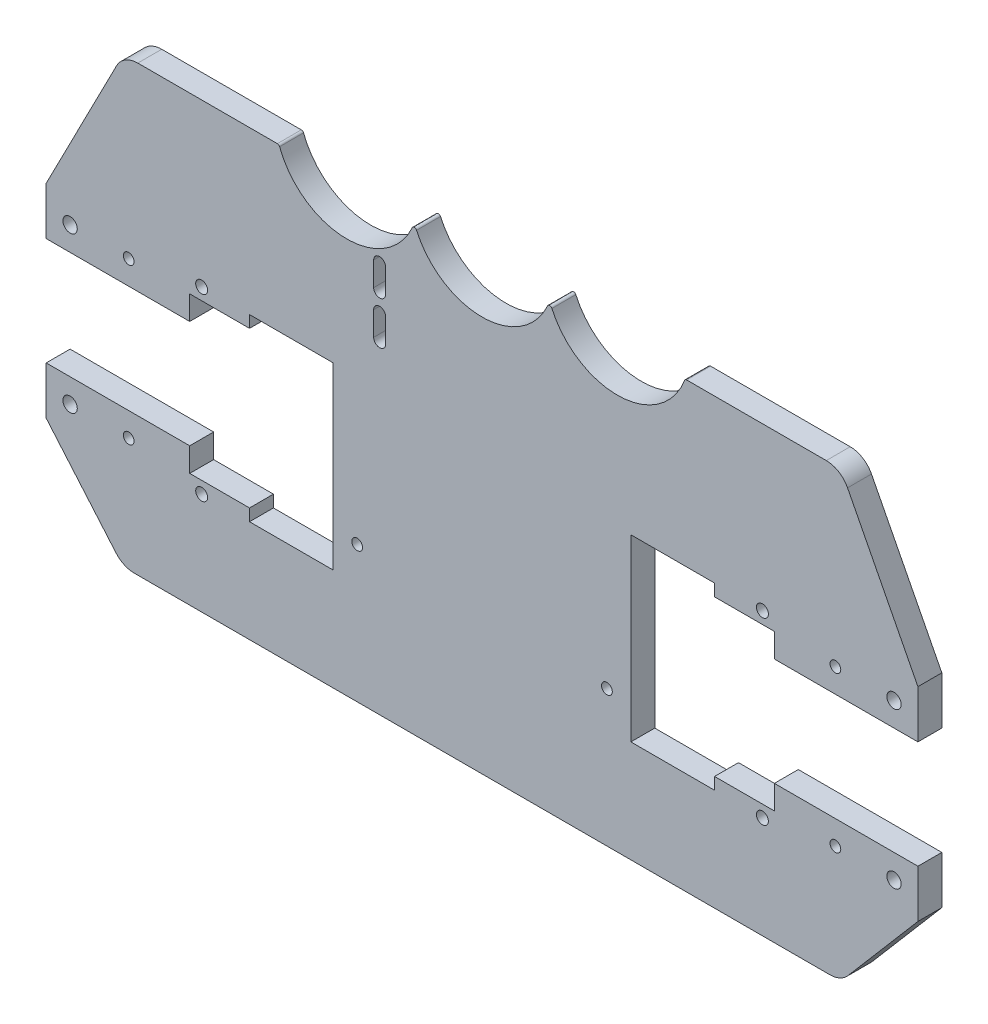
from build123d import *

# Parameters (mm, degrees)
BOSS_EXTRU_1_DEPTH           = 10
ENL_V_MAT_EXTRU_1_DEPTH      = 10
ENL_V_MAT_EXTRU_2_DEPTH      = 211.627348652
ENL_V_MAT_EXTRU_2_DEPTH_BACK = 10
ESQUISSE10_R                 = 2.25
ESQUISSE10_R_2               = 3
ENL_V_MAT_EXTRU_3_DEPTH      = 10
ESQUISSE15_R                 = 2.25
ENL_V_MAT_EXTRU_4_DEPTH      = 10
CONG_1_R                     = 10
CONG_3_R                     = 1
ENL_V_MAT_EXTRU_5_DEPTH      = 10
ESQUISSE18_R                 = 2.5
ENL_V_MAT_EXTRU_6_DEPTH      = 10


with BuildPart() as part:
    # Esquisse3 → Boss.-Extru.1 (new body)
    with BuildSketch(Plane.XY):
        Polygon((-150, 105.2), (-182.2, 42.5), (-182.2, -42.5), (-150, -80.2), (150, -80.2), (182.2, -42.5), (182.2, 42.5), (150, 105.2), align=None)
    extrude(amount=BOSS_EXTRU_1_DEPTH)

    # Esquisse4 → Enlèv. mat.-Extru.1 (cut)
    with BuildSketch(Plane.XY.offset(10)):
        Polygon((-97.2, 32.5), (-122.2, 32.5), (-122.2, 22.5), (-182.2, 22.5), (-182.2, -22.5), (-122.2, -22.5), (-122.2, -32.5), (-97.2, -32.5), (-97.2, -37.5), (-62.2, -37.5), (-62.2, 37.5), (-97.2, 37.5), align=None)
        Polygon((122.2, 22.5), (122.2, 32.5), (97.2, 32.5), (97.2, 37.5), (62.2, 37.5), (62.2, -37.5), (97.2, -37.5), (97.2, -32.5), (122.2, -32.5), (122.2, -22.5), (182.2, -22.5), (182.2, 22.5), align=None)
    extrude(amount=-ENL_V_MAT_EXTRU_1_DEPTH, mode=Mode.SUBTRACT)

    # Esquisse5 → Enlèv. mat.-Extru.2 (cut, two sides: drawn at the far end of the back side and taken through both)
    with BuildSketch(Plane.XY.offset(10).offset(-ENL_V_MAT_EXTRU_2_DEPTH_BACK)):
        with BuildLine():
            Line((304.919844735, 727.643559723), (84.852813742, 105.2))
            ThreePointArc((84.852813742, 105.2), (56.568542495, 85.2), (28.284271247, 105.2))
            ThreePointArc((28.284271247, 105.2), (0, 85.2), (-28.284271247, 105.2))
            ThreePointArc((-28.284271247, 105.2), (-56.568542495, 85.2), (-84.852813742, 105.2))
            Line((-84.852813742, 105.2), (-304.919844735, 727.643559723))
            Line((-304.919844735, 727.643559723), (-304.919844735, 2048.045745681))
            Line((-304.919844735, 2048.045745681), (304.919844735, 2048.045745681))
            Line((304.919844735, 2048.045745681), (304.919844735, 727.643559723))
        make_face()
    extrude(amount=ENL_V_MAT_EXTRU_2_DEPTH + ENL_V_MAT_EXTRU_2_DEPTH_BACK, mode=Mode.SUBTRACT)

    # Esquisse10 → Enlèv. mat.-Extru.3 (cut)
    with BuildSketch(Plane.XY.offset(10)):
        with Locations((-147.7, 32.5)):
            Circle(ESQUISSE10_R)
        with Locations((-172.2, 32.5)):
            Circle(ESQUISSE10_R_2)
        with Locations((-172.2, -32.5)):
            Circle(ESQUISSE10_R_2)
        with Locations((-147.7, -32.5)):
            Circle(ESQUISSE10_R)
        with Locations((172.2, 32.5)):
            Circle(ESQUISSE10_R_2)
        with Locations((147.7, 32.5)):
            Circle(ESQUISSE10_R)
        with Locations((172.2, -32.5)):
            Circle(ESQUISSE10_R_2)
        with Locations((147.7, -32.5)):
            Circle(ESQUISSE10_R)
    extrude(amount=-ENL_V_MAT_EXTRU_3_DEPTH, mode=Mode.SUBTRACT)

    # Esquisse15 → Enlèv. mat.-Extru.4 (cut)
    with BuildSketch(Plane.XY.offset(10)):
        with Locations((-52.2, -23.2)):
            Circle(ESQUISSE15_R)
        with Locations((52.2, -23.2)):
            Circle(ESQUISSE15_R)
    extrude(amount=-ENL_V_MAT_EXTRU_4_DEPTH, mode=Mode.SUBTRACT)

    # Congé1
    cong_1_edges = [part.edges().sort_by_distance(p)[0] for p in [
        (150, 105.2, 5),
        (150, -80.2, 5),
        (-150, 105.2, 5),
        (-150, -80.2, 5),
    ]]
    fillet(cong_1_edges, radius=CONG_1_R)

    # Congé3
    cong_3_edges = [part.edges().sort_by_distance(p)[0] for p in [
        (-84.852813742, 105.2, 5),
        (-28.284271247, 105.2, 5),
        (28.284271247, 105.2, 5),
        (84.852813742, 105.2, 5),
    ]]
    fillet(cong_3_edges, radius=CONG_3_R)

    # Esquisse17 → Enlèv. mat.-Extru.5 (cut)
    with BuildSketch(Plane.XY.offset(10)):
        with BuildLine():
            Line((-40.31, 83.2), (-40.31, 73.2))
            ThreePointArc((-40.31, 73.2), (-42.81, 70.7), (-45.31, 73.2))
            Line((-45.31, 73.2), (-45.31, 83.2))
            ThreePointArc((-45.31, 83.2), (-42.81, 85.7), (-40.31, 83.2))
        make_face()
        with BuildLine():
            Line((-40.31, 65.2), (-40.31, 55.2))
            ThreePointArc((-40.31, 55.2), (-42.81, 52.7), (-45.31, 55.2))
            Line((-45.31, 55.2), (-45.31, 65.2))
            ThreePointArc((-45.31, 65.2), (-42.81, 67.7), (-40.31, 65.2))
        make_face()
    extrude(amount=-ENL_V_MAT_EXTRU_5_DEPTH, mode=Mode.SUBTRACT)

    # Esquisse18 → Enlèv. mat.-Extru.6 (cut)
    with BuildSketch(Plane.XY.offset(10)):
        with Locations((117.2, -37.5)):
            Circle(ESQUISSE18_R)
        with Locations((117.2, 37.5)):
            Circle(ESQUISSE18_R)
        with Locations((-117.2, -37.5)):
            Circle(ESQUISSE18_R)
        with Locations((-117.2, 37.5)):
            Circle(ESQUISSE18_R)
    extrude(amount=-ENL_V_MAT_EXTRU_6_DEPTH, mode=Mode.SUBTRACT)


solid = part.part
